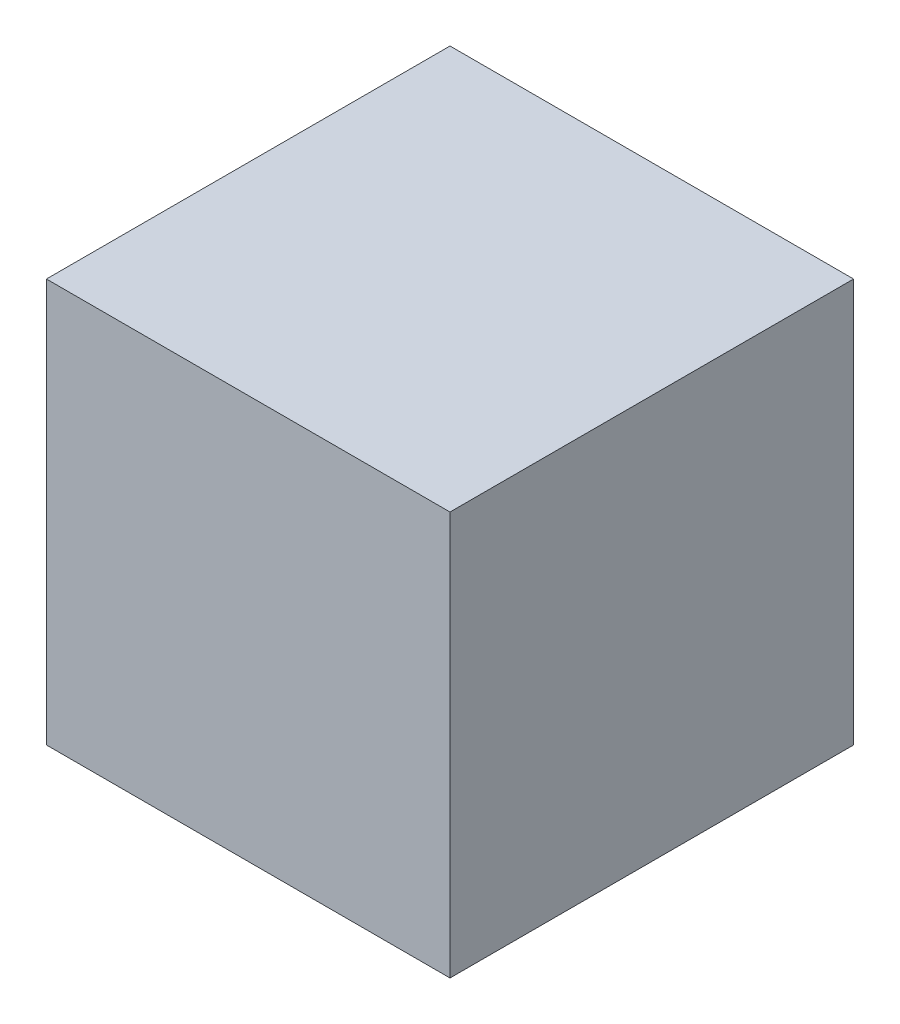
from build123d import *

# Parameters (mm, degrees)
SKETCH1_W           = 1
SKETCH1_H           = 1
BOSS_EXTRUDE1_DEPTH = 1


with BuildPart() as part:
    # Sketch1 → Boss-Extrude1 (new body)
    with BuildSketch(Plane.XY):
        with Locations((0.5, 0.5)):
            Rectangle(SKETCH1_W, SKETCH1_H)
    extrude(amount=BOSS_EXTRUDE1_DEPTH)


solid = part.part
